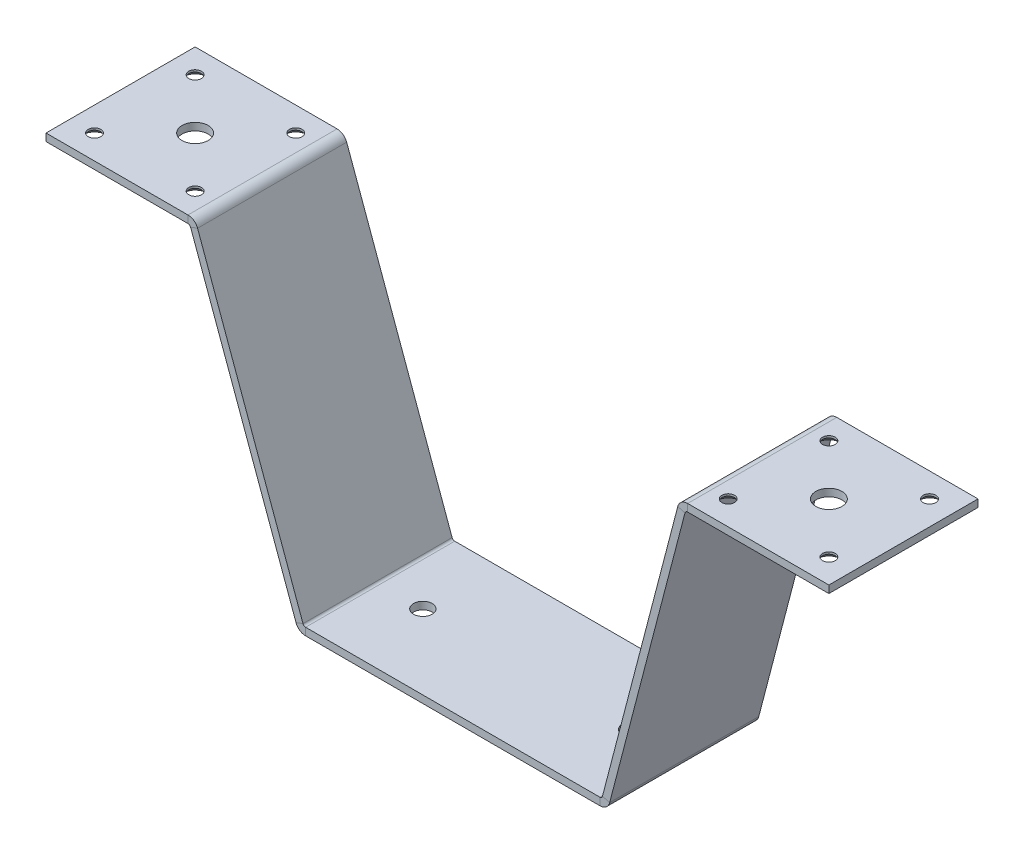
from build123d import *

# Parameters (mm, degrees)
SM_BASE_FLANGE_1_DEPTH      = 40
SKETCH_6_R                  = 2.5
CUT_EXTRUDE_1_DEPTH         = 229.962879087
HOLE_WIZARD_M3_1_AT_2_COUNT = 2
HOLE_WIZARD_M3_1_AT_2_PITCH = 27
HOLE_WIZARD_M3_1_AT_3_COUNT = 2
HOLE_WIZARD_M3_1_AT_3_PITCH = 38.183766184
HOLE_WIZARD_M3_1_AT_4_COUNT = 2
HOLE_WIZARD_M3_1_AT_4_PITCH = 27
HOLE_WIZARD_M3_1_AT_5_COUNT = 2
HOLE_WIZARD_M3_1_AT_5_PITCH = 172.130764246
HOLE_WIZARD_M3_1_AT_6_COUNT = 2
HOLE_WIZARD_M3_1_AT_6_PITCH = 198.841645537
HOLE_WIZARD_M3_1_AT_7_COUNT = 2
HOLE_WIZARD_M3_1_AT_7_PITCH = 170
HOLE_WIZARD_M3_1_AT_8_COUNT = 2
HOLE_WIZARD_M3_1_AT_8_PITCH = 197
HOLE_WIZARD_7_0_7_1_D       = 7
HOLE_WIZARD_7_0_7_1_DEPTH   = 2
HOLE_WIZARD_7_0_7_1_TIP     = 2.103012167


# Sheet-metal steps are written as plain solids
with BuildPart() as part:
    # Sketch 1 → 基材-凸緣1 (new body)
    with BuildSketch(Plane.XY):
        with BuildLine():
            Line((0, 0), (38.083812051, 0))
            ThreePointArc((38.083812051, 0), (39.653461327, -0.494908516), (40.655374877, -1.800627676))
            Line((40.655374877, -1.800627676), (68.941214029, -79.515332038))
            ThreePointArc((68.941214029, -79.515332038), (69.210895211, -79.866787396), (69.633391614, -80))
            Line((69.633391614, -80), (148.548612075, -80))
            ThreePointArc((148.548612075, -80), (148.998913005, -79.84633107), (149.261331062, -79.44944087))
            Line((149.261331062, -79.44944087), (169.46608317, -2.045425081))
            ThreePointArc((169.46608317, -2.045425081), (170.441012922, -0.570907404), (172.11396096, 0))
            Line((172.11396096, 0), (210, 0))
            Line((210, 0), (210, -2))
            Line((210, -2), (172.11396096, -2))
            ThreePointArc((172.11396096, -2), (171.66366003, -2.15366893), (171.401241973, -2.55055913))
            Line((171.401241973, -2.55055913), (151.196489865, -79.954574919))
            ThreePointArc((151.196489865, -79.954574919), (150.221560113, -81.429092596), (148.548612075, -82))
            Line((148.548612075, -82), (69.633391614, -82))
            ThreePointArc((69.633391614, -82), (68.063742338, -81.505091484), (67.061828788, -80.199372324))
            Line((67.061828788, -80.199372324), (38.775989635, -2.484667962))
            ThreePointArc((38.775989635, -2.484667962), (38.506308454, -2.133212604), (38.083812051, -2))
            Line((38.083812051, -2), (0, -2))
            Line((0, -2), (0, 0))
        make_face()
    extrude(amount=SM_BASE_FLANGE_1_DEPTH)

    # 草圖6 → 除料-伸長1 (cut, through all)
    with BuildSketch(Plane.XZ.offset(82)):
        with Locations((137.091001844, 20)):
            Circle(SKETCH_6_R)
        with Locations((81.091001844, 20)):
            Circle(SKETCH_6_R)
    extrude(amount=-CUT_EXTRUDE_1_DEPTH, mode=Mode.SUBTRACT)

    # 草圖13 → M3 高錐坑頭螺釘的錐孔1 (revolve, cut)
    with BuildSketch(Plane(origin=(6.5, -2, 33.5), x_dir=(0, 0, -1), z_dir=(1, 0, 0))):
        Polygon((0, 0), (0, 3.021463052), (1.7, 2), (1.7, 1.45), (3.15, 0), align=None)
    hole_wizard_m3_1 = revolve(axis=Axis((6.5, -8.35, 33.5), (0, 1, 0)), mode=Mode.SUBTRACT)

    # M3 高錐坑頭螺釘的錐孔1 at 2: M3 高錐坑頭螺釘的錐孔1 ×2
    with Locations(*[(i * HOLE_WIZARD_M3_1_AT_2_PITCH, 0, 0) for i in range(1, HOLE_WIZARD_M3_1_AT_2_COUNT)]):
        add(hole_wizard_m3_1, mode=Mode.SUBTRACT)

    # M3 高錐坑頭螺釘的錐孔1 at 3: M3 高錐坑頭螺釘的錐孔1 ×2
    with Locations(*[Vector(0.7071067811865476, 0, -0.7071067811865476) * (i * HOLE_WIZARD_M3_1_AT_3_PITCH) for i in range(1, HOLE_WIZARD_M3_1_AT_3_COUNT)]):
        add(hole_wizard_m3_1, mode=Mode.SUBTRACT)

    # M3 高錐坑頭螺釘的錐孔1 at 4: M3 高錐坑頭螺釘的錐孔1 ×2
    with Locations(*[(0, 0, -i * HOLE_WIZARD_M3_1_AT_4_PITCH) for i in range(1, HOLE_WIZARD_M3_1_AT_4_COUNT)]):
        add(hole_wizard_m3_1, mode=Mode.SUBTRACT)

    # M3 高錐坑頭螺釘的錐孔1 at 5: M3 高錐坑頭螺釘的錐孔1 ×2
    with Locations(*[Vector(0.9876212468143859, 0, -0.15685749214110833) * (i * HOLE_WIZARD_M3_1_AT_5_PITCH) for i in range(1, HOLE_WIZARD_M3_1_AT_5_COUNT)]):
        add(hole_wizard_m3_1, mode=Mode.SUBTRACT)

    # M3 高錐坑頭螺釘的錐孔1 at 6: M3 高錐坑頭螺釘的錐孔1 ×2
    with Locations(*[Vector(0.9907381296691129, 0, -0.13578644416784796) * (i * HOLE_WIZARD_M3_1_AT_6_PITCH) for i in range(1, HOLE_WIZARD_M3_1_AT_6_COUNT)]):
        add(hole_wizard_m3_1, mode=Mode.SUBTRACT)

    # M3 高錐坑頭螺釘的錐孔1 at 7: M3 高錐坑頭螺釘的錐孔1 ×2
    with Locations(*[(i * HOLE_WIZARD_M3_1_AT_7_PITCH, 0, 0) for i in range(1, HOLE_WIZARD_M3_1_AT_7_COUNT)]):
        add(hole_wizard_m3_1, mode=Mode.SUBTRACT)

    # M3 高錐坑頭螺釘的錐孔1 at 8: M3 高錐坑頭螺釘的錐孔1 ×2
    with Locations(*[(i * HOLE_WIZARD_M3_1_AT_8_PITCH, 0, 0) for i in range(1, HOLE_WIZARD_M3_1_AT_8_COUNT)]):
        add(hole_wizard_m3_1, mode=Mode.SUBTRACT)

    # Ø7.0 (7) 直徑孔1
    with Locations(Plane(origin=(0, -2, 0), x_dir=(-1, 0, 0), z_dir=(0, -1, 0))):
        with Locations((-20, -20), (-190, -20)):
            Hole(HOLE_WIZARD_7_0_7_1_D / 2, depth=HOLE_WIZARD_7_0_7_1_DEPTH)
            with Locations((0, 0, -(HOLE_WIZARD_7_0_7_1_DEPTH + HOLE_WIZARD_7_0_7_1_TIP / 2))):  # 118° drill point
                Cone(0, HOLE_WIZARD_7_0_7_1_D / 2, HOLE_WIZARD_7_0_7_1_TIP, mode=Mode.SUBTRACT)


solid = part.part
